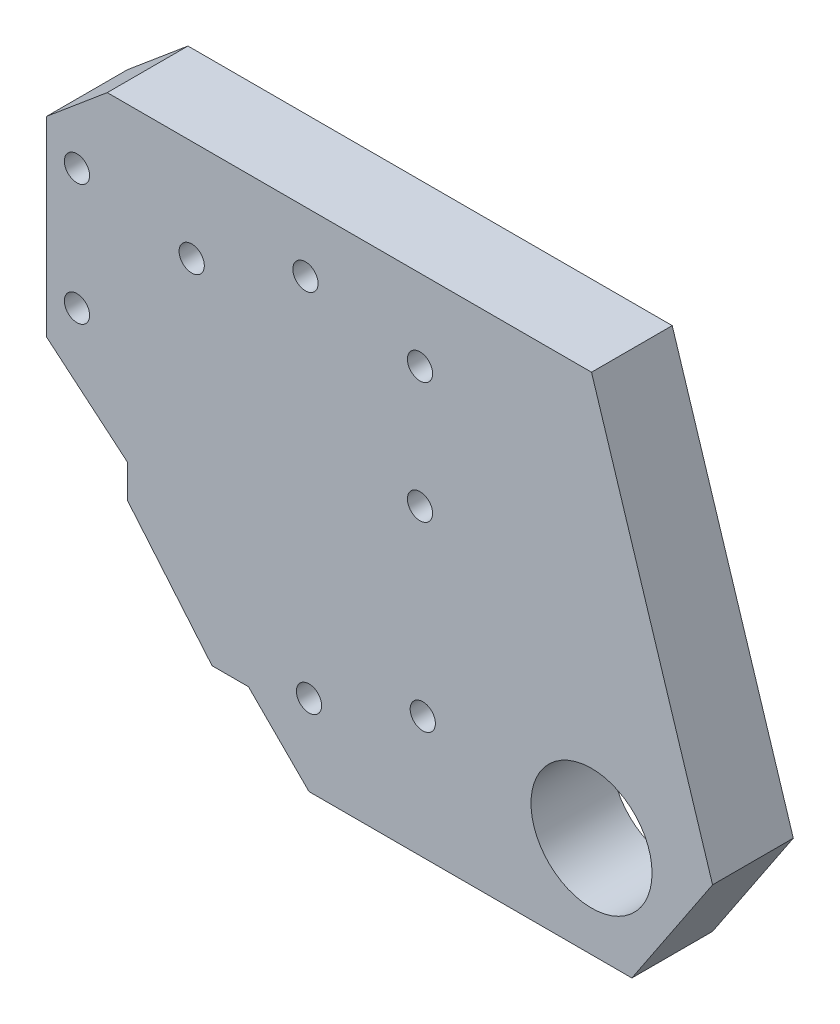
from build123d import *

# Parameters (mm, degrees)
SKETCH_1_R               = 3
EXTRUDE_1_DEPTH          = 4
HOLE_WIZARD_M1_6_1_D     = 1.25
HOLE_WIZARD_M1_6_1_DEPTH = 4.95
HOLE_WIZARD_M1_6_1_TIP   = 0.375537887
HOLE_WIZARD_M1_6_2_D     = 1.25
HOLE_WIZARD_M1_6_2_DEPTH = 4.95
HOLE_WIZARD_M1_6_2_TIP   = 0.375537887
CHAMFER_1_SIZE           = 5
CHAMFER_1_SIZE2          = 4.195498156
CHAMFER_2_SIZE2          = 4
CHAMFER_2_SIZE           = 3.356398525
CHAMFER_4_SIZE           = 3
CHAMFER_4_SIZE2          = 2.517298894


with BuildPart() as part:
    # 草图1 → 凸台-拉伸1 (new body)
    with BuildSketch(Plane.XY):
        Polygon((0, 3), (0, 13), (-4, 13), (-4, 25), (23, 25), (29, 6), (25, 0), (9, 0), (6, 3), align=None)
        with Locations((23, 5)):
            Circle(SKETCH_1_R, mode=Mode.SUBTRACT)
    extrude(amount=EXTRUDE_1_DEPTH)

    # M1.6 螺纹孔1
    with Locations(Plane.XY.offset(4)):
        with Locations((-2.5, 21), (14.5, 21), (14.5, 15), (-2.5, 15)):
            Hole(HOLE_WIZARD_M1_6_1_D / 2, depth=HOLE_WIZARD_M1_6_1_DEPTH)
            with Locations((0, 0, -(HOLE_WIZARD_M1_6_1_DEPTH + HOLE_WIZARD_M1_6_1_TIP / 2))):  # 118° drill point
                Cone(0, HOLE_WIZARD_M1_6_1_D / 2, HOLE_WIZARD_M1_6_1_TIP, mode=Mode.SUBTRACT)

    # M1.6 螺纹孔2
    with Locations(Plane.XY.offset(4)):
        with Locations((8.823813288, 22.026895413), (14.638155725, 6.05212086), (9, 4), (3.185657563, 19.974774553)):
            Hole(HOLE_WIZARD_M1_6_2_D / 2, depth=HOLE_WIZARD_M1_6_2_DEPTH)
            with Locations((0, 0, -(HOLE_WIZARD_M1_6_2_DEPTH + HOLE_WIZARD_M1_6_2_TIP / 2))):  # 118° drill point
                Cone(0, HOLE_WIZARD_M1_6_2_D / 2, HOLE_WIZARD_M1_6_2_TIP, mode=Mode.SUBTRACT)

    # 倒角1
    chamfer_1_edges = [part.edges().sort_by_distance(p)[0] for p in [
        (0, 3, 2),
    ]]
    chamfer_1_side = [part.faces().sort_by_distance(p)[0] for p in [
        (0, 8, 2),
    ]]
    chamfer(chamfer_1_edges, length=CHAMFER_1_SIZE, length2=CHAMFER_1_SIZE2, reference=chamfer_1_side[0])

    # 倒角2
    chamfer_2_edges = [part.edges().sort_by_distance(p)[0] for p in [
        (0, 13, 2),
    ]]
    chamfer_2_side = [part.faces().sort_by_distance(p)[0] for p in [
        (0, 12.93287203, 2),
    ]]
    chamfer(chamfer_2_edges, length=CHAMFER_2_SIZE - 0.0001, length2=CHAMFER_2_SIZE2 - 0.0001, reference=chamfer_2_side[0])  # a hair under: the kernel refuses the full size

    # 倒角4
    chamfer_4_edges = [part.edges().sort_by_distance(p)[0] for p in [
        (-4, 25, 2),
    ]]
    chamfer_4_side = [part.faces().sort_by_distance(p)[0] for p in [
        (9.5, 25, 2),
    ]]
    chamfer(chamfer_4_edges, length=CHAMFER_4_SIZE, length2=CHAMFER_4_SIZE2, reference=chamfer_4_side[0])


solid = part.part
